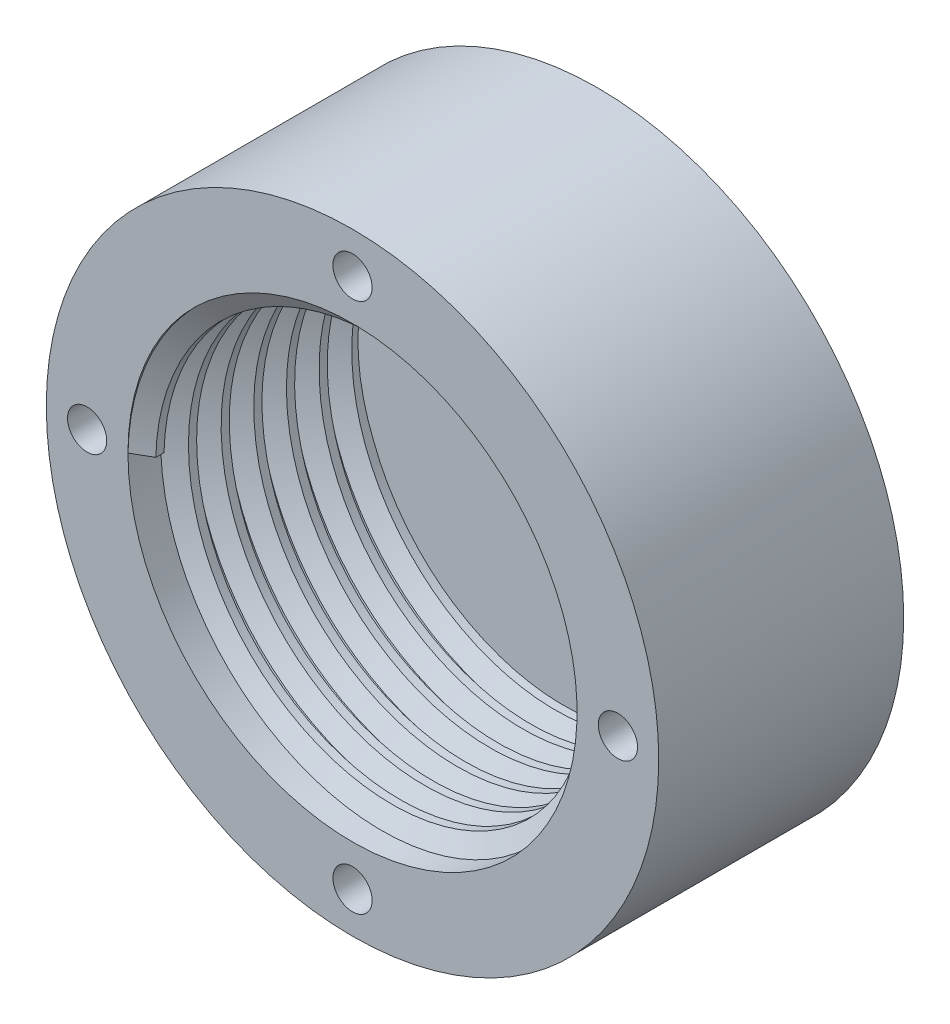
from build123d import *
from build123d.topology import SkipClean

# Parameters (mm, degrees)
CROQUIS1_R              = 37.5
SALIENTE_EXTRUIR1_DEPTH = 30
CROQUIS2_R              = 27.5
CORTAR_EXTRUIR1_DEPTH   = 26
ROSCA1_PITCH            = 4
CROQUIS10_R             = 6.55
CORTAR_EXTRUIR2_DEPTH   = 10
CROQUIS12_R             = 2.4
CORTAR_EXTRUIR3_DEPTH   = 34


with BuildPart() as part:
    # Croquis1 → Saliente-Extruir1 (new body)
    with BuildSketch(Plane.XY):
        Circle(CROQUIS1_R)
    extrude(amount=SALIENTE_EXTRUIR1_DEPTH)

    # Croquis2 → Cortar-Extruir1 (cut)
    with BuildSketch(Plane.XY.offset(30)):
        Circle(CROQUIS2_R)
    extrude(amount=-CORTAR_EXTRUIR1_DEPTH, mode=Mode.SUBTRACT)

    # Rosca1: the profile of Perfil de rosca1 profile screwed along a right-hand helix of 6.25 turns, 12 arcs to a turn; built about Z, then put on its axis
    with SkipClean():  # the faces are left unmerged after this step: merging them gives an invalid solid
        rosca1_z = Axis((0, 0, 0), (0, 0, 1))
        rosca1_corners = [(27.5003, 0, -0.000173205), (27.5003, 0, 3.500173194), (25.3349365, 0, 2.249999995), (25.3349365, 0, 1.249999995)]
        with BuildLine(mode=Mode.PRIVATE) as rosca1_profile:
            Line(rosca1_corners[0], rosca1_corners[1])
            Line(rosca1_corners[1], rosca1_corners[2])
            Line(rosca1_corners[2], rosca1_corners[3])
            Line(rosca1_corners[3], rosca1_corners[0])
        rosca1_cap = Face(rosca1_profile.wire())
        rosca1_turn_angles = [0, 15, 30, 45, 60, 75, 90, 105, 120, 135, 150, 165, 180, 195, 210, 225, 240, 255, 270, 285, 300, 315, 330, 345, 360]
        rosca1_turn_weights = [1, 0.9659258262890683, 1, 0.9659258262890683, 1, 0.9659258262890683, 1, 0.9659258262890683, 1, 0.9659258262890683, 1, 0.9659258262890683, 1, 0.9659258262890683, 1, 0.9659258262890683, 1, 0.9659258262890683, 1, 0.9659258262890683, 1, 0.9659258262890683, 1, 0.9659258262890683, 1]
        rosca1_turn_rails = [Edge.make_bspline([Vector(p[0], p[1], 0).rotate(rosca1_z, rosca1_turn_angles[k]) / rosca1_turn_weights[k] + Vector(0, 0, p[2] + ROSCA1_PITCH * rosca1_turn_angles[k] / 360) for k in range(25)], [0, 0, 0, 1, 1, 2, 2, 3, 3, 4, 4, 5, 5, 6, 6, 7, 7, 8, 8, 9, 9, 10, 10, 11, 11, 12, 12, 12], 2, rosca1_turn_weights) for p in rosca1_corners]
        rosca1_turn_sides = [Face.make_surface_from_curves(rosca1_turn_rails[p[0]], rosca1_turn_rails[p[1]]) for p in [(0, 1), (1, 2), (2, 3), (3, 0)]]
        rosca1_last_angles = [2160, 2175, 2190, 2205, 2220, 2235, 2250]
        rosca1_last_weights = [1, 0.9659258262890683, 1, 0.9659258262890683, 1, 0.9659258262890683, 1]
        rosca1_last_rails = [Edge.make_bspline([Vector(p[0], p[1], 0).rotate(rosca1_z, rosca1_last_angles[k]) / rosca1_last_weights[k] + Vector(0, 0, p[2] + ROSCA1_PITCH * rosca1_last_angles[k] / 360) for k in range(7)], [0, 0, 0, 1, 1, 2, 2, 3, 3, 3], 2, rosca1_last_weights) for p in rosca1_corners]
        rosca1_last_sides = [Face.make_surface_from_curves(rosca1_last_rails[p[0]], rosca1_last_rails[p[1]]) for p in [(0, 1), (1, 2), (2, 3), (3, 0)]]
        rosca1 = Plane(origin=(0, 0, 30), x_dir=(-1, 0, 0), z_dir=(0, 0, -1)) * Solid(Shell([*[p.moved(Location((0, 0, ROSCA1_PITCH * i))) for i in range(6) for p in rosca1_turn_sides], *rosca1_last_sides, rosca1_cap, rosca1_cap.rotate(rosca1_z, 2250).moved(Location((0, 0, ROSCA1_PITCH * 2250 / 360)))]))
        add(rosca1)

    # Croquis10 → Cortar-Extruir2 (cut)
    with SkipClean():  # the faces are left unmerged after this step: merging them gives an invalid solid
        with BuildSketch(Plane(origin=(0, 0, 0), x_dir=(-1, 0, 0), z_dir=(0, 0, -1))):
            Circle(CROQUIS10_R)
        extrude(amount=-CORTAR_EXTRUIR2_DEPTH, mode=Mode.SUBTRACT)

    # Croquis12 → Cortar-Extruir3 (cut)
    with BuildSketch(Plane.XY.offset(30)):
        with Locations((0, 32.5)):
            Circle(CROQUIS12_R)
        with Locations((32.5, 0)):
            Circle(CROQUIS12_R)
        with Locations((0, -32.5)):
            Circle(CROQUIS12_R)
        with Locations((-32.5, 0)):
            Circle(CROQUIS12_R)
    extrude(amount=-CORTAR_EXTRUIR3_DEPTH, mode=Mode.SUBTRACT)


solid = part.part
